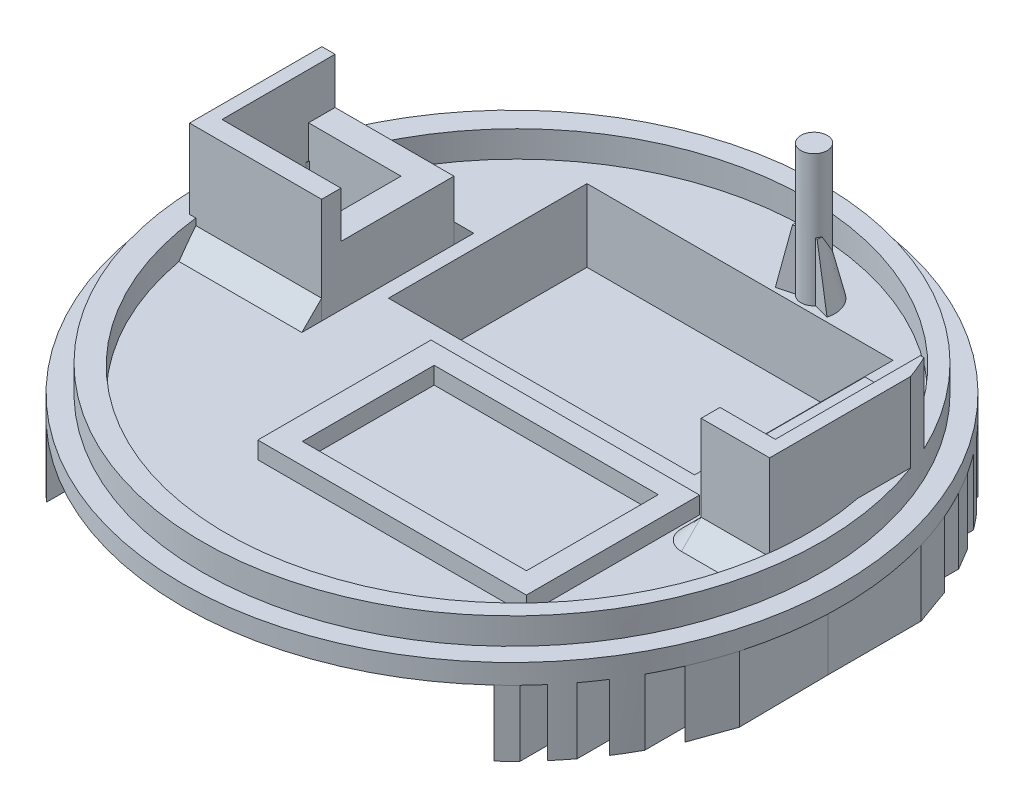
from build123d import *

# Parameters (mm, degrees)
BOSS_EXTRUDE1_DEPTH       = 0.5
BOSS_EXTRUDE1_DEPTH_BACK  = 1
SKETCH1_R                 = 25
SKETCH17_R                = 23.5
SKETCH17_R_2              = 22.038870545
BOSS_EXTRUDE15_DEPTH      = 2
SKETCH2_R                 = 1
BOSS_EXTRUDE2_DEPTH       = 10
BOSS_EXTRUDE11_DEPTH      = 5
SKETCH12_W                = 23.219340148
SKETCH12_H                = 15.058436642
CUT_EXTRUDE2_DEPTH        = 5
SKETCH15_W                = 24.972946701
SKETCH15_H                = 16.75913787
SKETCH15_W_2              = 23.219340148
SKETCH15_H_2              = 15.058436642
BOSS_EXTRUDE13_DEPTH      = 5
BOSS_EXTRUDE14_DEPTH      = 0.0001
BOSS_EXTRUDE14_DEPTH_BACK = 1
SKETCH16_W                = 24.972946701
SKETCH16_H                = 16.75913787
BOSS_EXTRUDE16_DEPTH      = 8
BOSS_EXTRUDE17_DEPTH      = 1.301
BOSS_EXTRUDE18_DEPTH      = 4.5
REVOLVE1_ANGLE            = 195
REVOLVE1_OTHER_WAY_ANGLE  = 15
BOSS_EXTRUDE20_DEPTH      = 7.5
BOSS_EXTRUDE21_DEPTH      = 7.5
BOSS_EXTRUDE22_DEPTH      = 0.0001
BOSS_EXTRUDE22_DEPTH_BACK = 10.05
BOSS_EXTRUDE23_DEPTH      = 0.0001
BOSS_EXTRUDE23_DEPTH_BACK = 5.2001
REVOLVE2_ANGLE            = 90
BOSS_EXTRUDE25_DEPTH      = 12.41001
REVOLVE3_ANGLE            = 90
BOSS_EXTRUDE26_DEPTH      = 3.41001
BOSS_EXTRUDE27_DEPTH      = 0.001
BOSS_EXTRUDE27_DEPTH_BACK = 8.41001
BOSS_EXTRUDE28_DEPTH      = 7.001


# Read off the part's stored shape, not the designer's step: Boss-Extrude16, Boss-Extrude18
with BuildPart() as part:
    # Sketch1 → Boss-Extrude1 (new, two sides: drawn at the far end of the back side and taken through both)
    with BuildSketch(Plane(origin=(0, 0, 0), x_dir=(1, 0, 0), z_dir=(0, 1, 0)).offset(-BOSS_EXTRUDE1_DEPTH_BACK)):
        with Locations(Location((0, 0, 0), (0, 0, 270))):
            Circle(SKETCH1_R)
    extrude(amount=BOSS_EXTRUDE1_DEPTH + BOSS_EXTRUDE1_DEPTH_BACK)

    # Sketch17 → Boss-Extrude15 (add)
    with BuildSketch(Plane(origin=(0, 0.5, 0), x_dir=(1, 0, 0), z_dir=(0, 1, 0))):
        with Locations(Location((0, 0, 0), (0, 0, 270))):
            Circle(SKETCH17_R)
        with Locations(Location((0.378928968, 0, 0), (0, 0, 270))):
            Circle(SKETCH17_R_2, mode=Mode.SUBTRACT)
    extrude(amount=BOSS_EXTRUDE15_DEPTH)

    # Sketch2 → Boss-Extrude2 (add)
    with BuildSketch(Plane(origin=(0, 0.5, 0), x_dir=(1, 0, 0), z_dir=(0, 1, 0))):
        with Locations(Location((5, 17.917691699, 0), (0, 0, 270))):
            Circle(SKETCH2_R)
    extrude(amount=BOSS_EXTRUDE2_DEPTH)

    # Sketch14 → Boss-Extrude11 (add)
    with BuildSketch(Plane.XZ.offset(1)):
        with BuildLine():
            Line((-20.013234661, 0), (-20.013234661, -14.982337549))
            ThreePointArc((-20.013234661, -14.982337549), (-19.5217563, -15.617331109), (-19.01013874, -16.236213385))
            Line((-19.01013874, -16.236213385), (-19.01013874, 0))
            Line((-19.01013874, 0), (-20.013234661, 0))
        make_face()
        with BuildLine():
            ThreePointArc((-19.01013874, 16.236213385), (-19.5217563, 15.617331109), (-20.013234661, 14.982337549))
            Line((-20.013234661, 14.982337549), (-20.013234661, 14.219543585))
            Line((-20.013234661, 14.219543585), (-20.013234661, 0))
            Line((-20.013234661, 0), (-19.01013874, 0))
            Line((-19.01013874, 0), (-19.01013874, 16.236213385))
        make_face()
        with BuildLine():
            Line((-22.003120492, 11.868558827), (-22.003120492, 0))
            Line((-22.003120492, 0), (-22.003120492, -11.868558827))
            ThreePointArc((-22.003120492, -11.868558827), (-21.521946756, -12.720291185), (-21.007819435, -13.552546719))
            Line((-21.007819435, -13.552546719), (-21.007819435, 0))
            Line((-21.007819435, 0), (-21.007819435, 13.552546719))
            ThreePointArc((-21.007819435, 13.552546719), (-21.521946756, 12.720291185), (-22.003120492, 11.868558827))
        make_face()
        Polygon((-23.929592496, 7.237029985), (-24.00431724, 0), (-23.00431724, 0), (-22.900778107, 10.027679797), align=None)
        Polygon((-23.102951801, -9.552675963), (-24.07392421, -6.741377687), (-24.00431724, 0), (-23.00431724, 0), align=None)
        Polygon((16.978448552, 0), (16.978448552, -18.350266613), (17.978448552, -17.371683501), (17.978448552, 0), align=None)
        with BuildLine():
            ThreePointArc((19.978448552, 15.02869234), (19.488385916, 15.658953171), (18.978448552, 16.273244623))
            Line((18.978448552, 16.273244623), (18.978448552, 0))
            Line((18.978448552, 0), (19.978448552, 0))
            Line((19.978448552, 0), (19.978448552, 15.02869234))
        make_face()
        Polygon((17.978448552, 17.371683501), (16.978448552, 18.350266613), (16.978448552, 0), (17.978448552, 0), align=None)
        Polygon((21.981386368, 0), (21.981386368, 11.908763719), (20.981386368, 11.858054365), (20.981386368, 0), align=None)
        with BuildLine():
            Line((19.978448552, 0), (18.978448552, 0))
            Line((18.978448552, 0), (18.978448552, -16.273244623))
            ThreePointArc((18.978448552, -16.273244623), (19.488385916, -15.658953171), (19.978448552, -15.02869234))
            Line((19.978448552, -15.02869234), (19.978448552, 0))
        make_face()
        Polygon((21.981386368, 0), (21.981386368, -11.908763719), (20.981386368, -13.593433196), (20.981386368, 0), align=None)
        Polygon((23.981386368, -7.063505351), (23.981386368, 0), (22.981386368, 0), (22.981386368, -9.841538527), align=None)
        Polygon((24.054519754, 6.810292166), (22.981386368, 9.841538527), (22.981386368, 0), (23.981386368, 0), align=None)
        with BuildLine():
            ThreePointArc((21.981386368, 11.908763719), (21.49651613, 12.763220373), (20.978448552, 13.597966625))
            Line((20.978448552, 13.597966625), (20.978448552, 0))
            Line((20.978448552, 0), (20.978448552, -13.597966625))
            ThreePointArc((20.978448552, -13.597966625), (20.979917583, -13.59569999), (20.981386368, -13.593433196))
            Line((20.981386368, -13.593433196), (20.981386368, 0))
            Line((20.981386368, 0), (20.981386368, 11.858054365))
            Line((20.981386368, 11.858054365), (21.981386368, 11.908763719))
        make_face()
        Polygon((-17.008979136, -18.321971203), (-18.008979136, -17.340030867), (-18.008979136, 0), (-17.008979136, 0), align=None)
        Polygon((-18.008979136, 17.340030867), (-17.008979136, 18.321971203), (-17.008979136, 0), (-18.008979136, 0), align=None)
    extrude(amount=BOSS_EXTRUDE11_DEPTH)

    # Sketch12 → Cut-Extrude2 (cut)
    with BuildSketch(Plane(origin=(0, 0.5, 0), x_dir=(1, 0, 0), z_dir=(0, 1, 0))):
        with Locations((0.666876956, 9.102631979)):
            Rectangle(SKETCH12_W, SKETCH12_H)
    extrude(amount=-CUT_EXTRUDE2_DEPTH, mode=Mode.SUBTRACT)

    # Sketch15 → Boss-Extrude13 (add)
    with BuildSketch(Plane.XZ.offset(1)):
        with Locations((0.596477735, -9.107727728)):
            Rectangle(SKETCH15_W, SKETCH15_H)
        with Locations((0.666876956, -9.102631979)):
            Rectangle(SKETCH15_W_2, SKETCH15_H_2, mode=Mode.SUBTRACT)
    extrude(amount=BOSS_EXTRUDE13_DEPTH)

    # Boss-Extrude16 outline → Boss-Extrude16 (add)
    with BuildSketch(Plane(origin=(0, 0.5, 0), x_dir=(1, 0, 0), z_dir=(0, 1, 0))):
        with BuildLine():
            Line((21.278371263, 9.97401205), (21.005108017, 9.97401205))
            Line((21.005108017, 9.97401205), (21.005108017, -1.02598795))
            Line((21.005108017, -1.02598795), (16.80718978, -1.02598795))
            Line((16.80718978, -1.02598795), (16.80718978, -2.458711062))
            Line((16.80718978, -2.458711062), (22.005108017, -2.458711062))
            Line((22.005108017, -2.458711062), (22.005108017, 8.247740366))
            ThreePointArc((22.005108017, 8.247740366), (21.658944991, 9.118119425), (21.278371263, 9.97401205))
        make_face()
        Polygon((-22, -2.465798727), (-11.97807381, -2.465798727), (-11.97807381, -1), (-21, -1), (-21, 7.575525784), (-22, 7.575525784), align=None)
    extrude(amount=BOSS_EXTRUDE16_DEPTH)

    # Sketch18 → Boss-Extrude17 (add)
    with BuildSketch(Plane(origin=(0, 0.5, 0), x_dir=(1, 0, 0), z_dir=(0, 1, 0))):
        Polygon((0, -2.402962183), (0, -0.862974972), (-5.282158739, -0.862974972), (-5.282158739, -14.003106764), (0, -14.003106764), (0, -12.402962183), (-3.5, -12.402962183), (-3.5, -2.402962183), align=None)
        Polygon((15.094136196, -0.862974972), (0.201079682, -0.862974972), (0.559908327, -2.402962183), (13.5, -2.402962183), (13.5, -12.402962183), (2.889983811, -12.402962183), (3.262829577, -14.003106764), (15.094136196, -14.003106764), align=None)
        Polygon((2.889983811, -12.402962183), (0, -12.402962183), (0, -14.003106764), (3.262829577, -14.003106764), align=None)
        Polygon((0.201079682, -0.862974972), (0, -0.862974972), (0, -2.402962183), (0.559908327, -2.402962183), align=None)
    extrude(amount=BOSS_EXTRUDE17_DEPTH)

    # Boss-Extrude18 outline → Boss-Extrude18 (add)
    with BuildSketch(Plane(origin=(0, 0.5, 0), x_dir=(1, 0, 0), z_dir=(0, 1, 0))):
        with BuildLine():
            Line((16.80718978, 9.972233135), (16.80718978, -1.02598795))
            Line((16.80718978, -1.02598795), (18.818512993, -1.02598795))
            Line((18.818512993, -1.02598795), (18.818512993, 7.959494075))
            Line((18.818512993, 7.959494075), (20.930285832, 7.959494075))
            ThreePointArc((20.930285832, 7.959494075), (20.506206092, 8.978002587), (20.031687006, 9.97401205))
            Line((20.031687006, 9.97401205), (18.818512993, 9.97401205))
            Line((18.818512993, 9.97401205), (18.818512993, 9.972233135))
            Line((18.818512993, 9.972233135), (16.80718978, 9.972233135))
        make_face()
        Polygon((-13.988084857, -1), (-11.97807381, -1), (-11.97807381, 7.575525784), (-21, 7.575525784), (-21, 5.565099869), (-13.988084857, 5.565099869), align=None)
    extrude(amount=BOSS_EXTRUDE18_DEPTH)

    # Sketch22 → Revolve1 (revolve)
    with BuildSketch(Plane(origin=(0, 0, -17.487296663), x_dir=(-1, 0, 0), z_dir=(0, 0, -1))):
        Polygon((-4.976750106, 2.5), (-4.976750106, 4.97103297), (-5.944220353, 4.97103297), (-7.362854562, -1), (-4.976750106, -1), align=None)
    revolve(axis=Axis((4.976750106, 2.5, -17.487296663), (0, 1, 0)), revolution_arc=REVOLVE1_ANGLE)

    # Sketch22 → Revolve1 other way (revolve)
    with BuildSketch(Plane(origin=(0, 0, -17.487296663), x_dir=(-1, 0, 0), z_dir=(0, 0, -1))):
        Polygon((-4.976750106, 2.5), (-4.976750106, 4.97103297), (-5.944220353, 4.97103297), (-7.362854562, -1), (-4.976750106, -1), align=None)
    revolve(axis=Axis((4.976750106, 2.5, -17.487296663), (0, -1, 0)), revolution_arc=REVOLVE1_OTHER_WAY_ANGLE)

    # Sketch23 → Boss-Extrude20 (add)
    with BuildSketch(Plane(origin=(0, 0, 1), x_dir=(-1, 0, 0), z_dir=(0, 0, -1))):
        Polygon((21, 0.5), (21, 2.00493968), (19.5, 0.5), align=None)
    extrude(amount=BOSS_EXTRUDE20_DEPTH)

    # Sketch24 → Boss-Extrude21 (add)
    with BuildSketch(Plane.ZY.offset(13.988084857)):
        Polygon((1, 0.5), (1, 2), (-0.5, 0.5), align=None)
    extrude(amount=BOSS_EXTRUDE21_DEPTH)

    # Sketch25 → Boss-Extrude22 (add, two sides: drawn at the far end of the back side and taken through both)
    with BuildSketch(Plane(origin=(-11.97807381, 0, 0), x_dir=(0, 0, -1), z_dir=(1, 0, 0)).offset(-BOSS_EXTRUDE22_DEPTH_BACK)):
        Polygon((-2.465798727, 0.5), (-3.965798727, 0.5), (-2.465798727, 2), align=None)
    extrude(amount=BOSS_EXTRUDE22_DEPTH + BOSS_EXTRUDE22_DEPTH_BACK)

    # Sketch28 → Boss-Extrude23 (add, two sides: drawn at the far end of the back side and taken through both)
    with BuildSketch(Plane.ZY.offset(-16.80718978).offset(-BOSS_EXTRUDE23_DEPTH_BACK)):
        Polygon((2.458711062, 2.003228909), (2.458711062, 0.5), (3.95259513, 0.5), align=None)
    extrude(amount=BOSS_EXTRUDE23_DEPTH + BOSS_EXTRUDE23_DEPTH_BACK)

    # Sketch30 → Revolve2 (revolve)
    with BuildSketch(Plane.ZY.offset(-16.80708978)):
        Polygon((2.458711062, 2.003228909), (2.458711062, 0.5), (3.95259513, 0.5), align=None)
    revolve(axis=Axis((16.80708978, 2.003228909, 2.458711062), (0, -1, 0)), revolution_arc=REVOLVE2_ANGLE)

    # Sketch31 → Boss-Extrude25 (add)
    with BuildSketch(Plane(origin=(0, 0, 2.458711062), x_dir=(-1, 0, 0), z_dir=(0, 0, -1))):
        Polygon((-16.792249437, 1.988295734), (-16.792249437, 0.5), (-15.313205712, 0.5), align=None)
    extrude(amount=BOSS_EXTRUDE25_DEPTH)

    # Sketch32 → Revolve3 (revolve)
    with BuildSketch(Plane(origin=(0, 0, -9.951298938), x_dir=(-1, 0, 0), z_dir=(0, 0, -1))):
        Polygon((-16.792249437, 1.988295734), (-16.792249437, 0.5), (-15.313205712, 0.5), align=None)
    revolve(axis=Axis((16.792249437, 1.988295734, -9.951298938), (0, -1, 0)), revolution_arc=REVOLVE3_ANGLE)

    # Sketch33 → Boss-Extrude26 (add)
    with BuildSketch(Plane(origin=(16.792249437, 0, 0), x_dir=(0, 0, -1), z_dir=(1, 0, 0))):
        Polygon((9.951298938, 1.988295734), (11.430342663, 0.5), (9.951298938, 0.5), (9.915470666, 0.5), (9.915470666, 1.988295734), align=None)
    extrude(amount=BOSS_EXTRUDE26_DEPTH)

    # Sketch34 → Boss-Extrude27 (add, two sides: drawn at the far end of the back side and taken through both)
    with BuildSketch(Plane(origin=(-11.97807381, 0, 0), x_dir=(0, 0, -1), z_dir=(1, 0, 0)).offset(-BOSS_EXTRUDE27_DEPTH_BACK)):
        Polygon((7.575525784, 0.5), (9.075525784, 0.5), (7.575525784, 2), align=None)
    extrude(amount=BOSS_EXTRUDE27_DEPTH + BOSS_EXTRUDE27_DEPTH_BACK)

    # Sketch37 → Boss-Extrude28 (add)
    with BuildSketch(Plane.XY.offset(-5.565099869)):
        Polygon((-13.988084857, 0.5), (-13.988084857, 2), (-15.488084857, 0.5), align=None)
    extrude(amount=BOSS_EXTRUDE28_DEPTH)


with BuildPart() as body_2:
    # Sketch16 → Boss-Extrude14 (new, two sides: drawn at the far end of the back side and taken through both)
    with BuildSketch(Plane(origin=(0, -6, 0), x_dir=(-1, 0, 0), z_dir=(0, -1, 0)).offset(-BOSS_EXTRUDE14_DEPTH_BACK)):
        with Locations((-0.596477735, 9.107727728)):
            Rectangle(SKETCH16_W, SKETCH16_H)
    extrude(amount=BOSS_EXTRUDE14_DEPTH + BOSS_EXTRUDE14_DEPTH_BACK)


solid = Compound([part.part, body_2.part])
